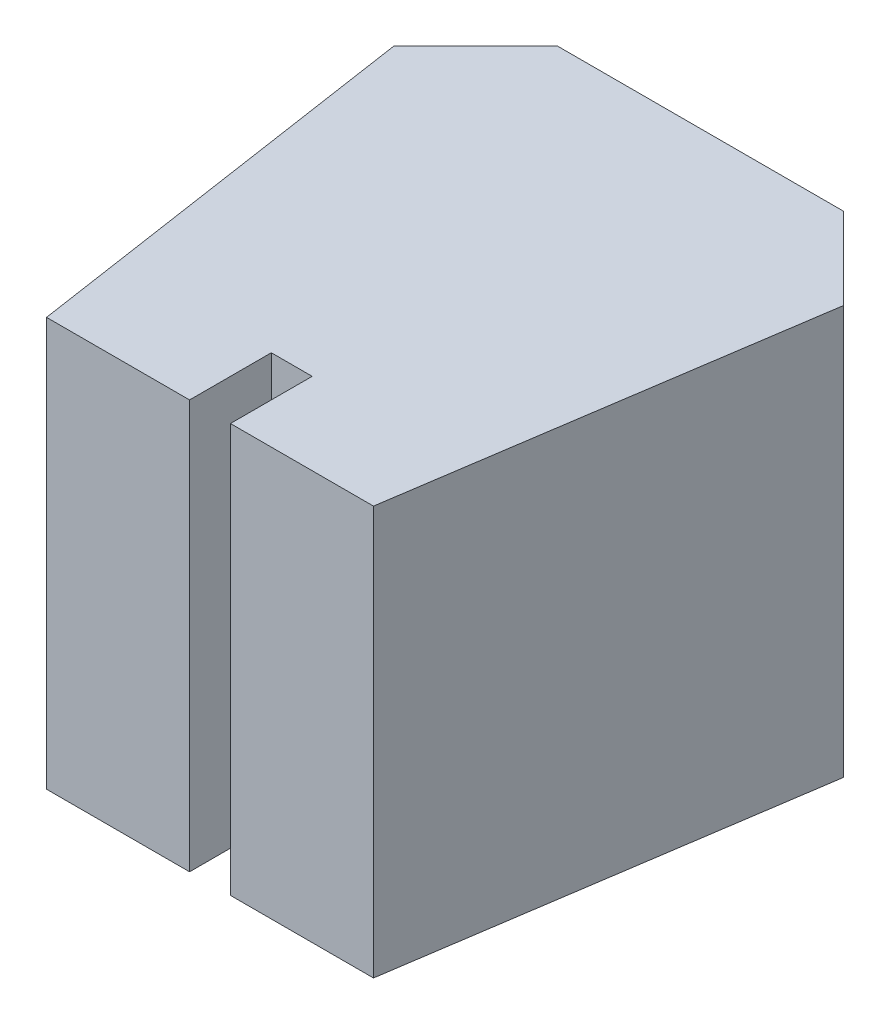
from build123d import *

# Parameters (mm, degrees)
BOSS_EXTRUDE1_DEPTH = 500


with BuildPart() as part:
    # Sketch1 → Boss-Extrude1 (new body)
    with BuildSketch(Plane(origin=(0, 0, -208.185399822), x_dir=(-1, 0, 0), z_dir=(0, -1, 0))):
        Polygon((175, 91.814600178), (-175, 91.814600178), (-275, -8.185399822), (-200, -508.185399822), (-25, -508.185399822), (-25, -408.185399822), (25, -408.185399822), (25, -508.185399822), (200, -508.185399822), (275, -8.185399822), align=None)
    extrude(amount=BOSS_EXTRUDE1_DEPTH)


solid = part.part
